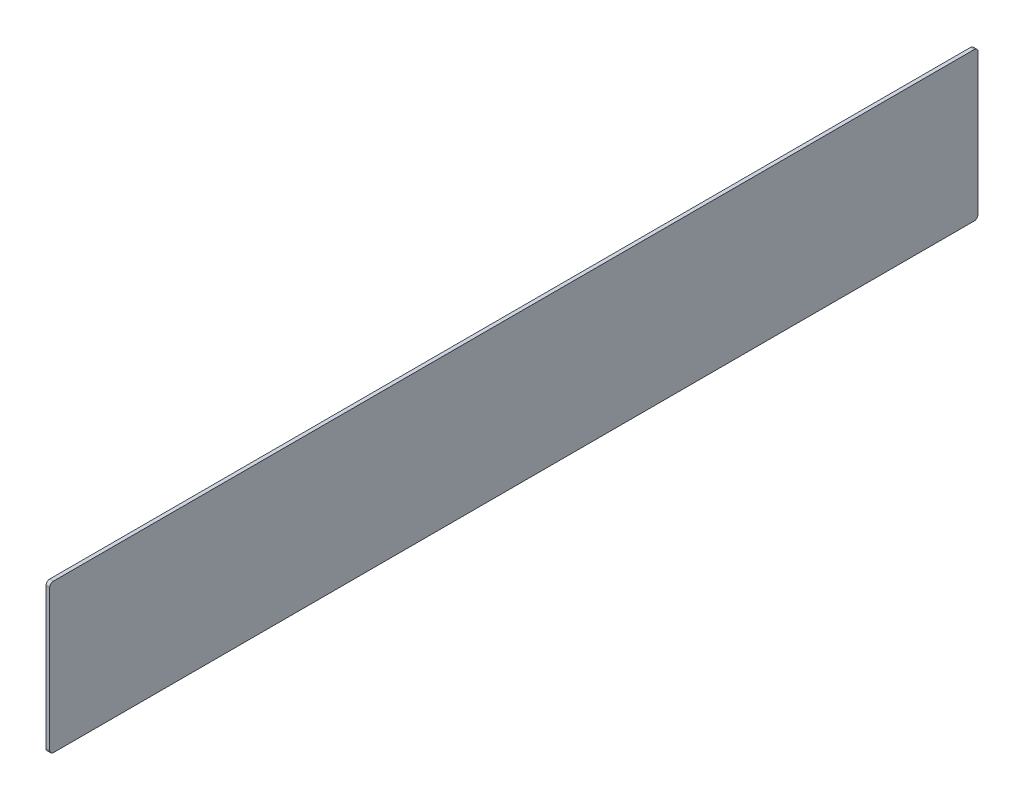
from build123d import *

# Parameters (mm, degrees)
SKETCH1_W           = 500
SKETCH1_H           = 80
BOSS_EXTRUDE1_DEPTH = 2
FILLET1_R           = 2


with BuildPart() as part:
    # Sketch1 → Boss-Extrude1 (new body)
    with BuildSketch(Plane(origin=(0, 0, 0), x_dir=(0, 0, -1), z_dir=(1, 0, 0))):
        with Locations((-19.946808511, -100.292553191)):
            Rectangle(SKETCH1_W, SKETCH1_H)
    extrude(amount=BOSS_EXTRUDE1_DEPTH)

    # Fillet1
    fillet1_edges = [part.edges().sort_by_distance(p)[0] for p in [
        (1, -140.292553191, -230.053191489),
        (1, -60.292553191, -230.053191489),
        (1, -140.292553191, 269.946808511),
        (1, -60.292553191, 269.946808511),
    ]]
    fillet(fillet1_edges, radius=FILLET1_R)


solid = part.part
